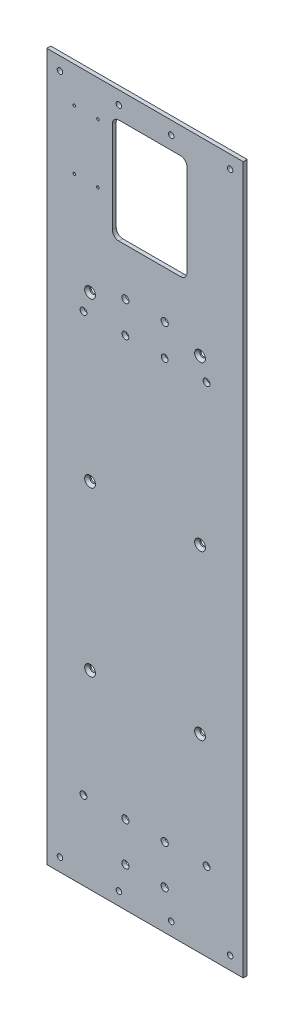
from build123d import *

# Parameters (mm, degrees)
SKETCH_1_W          = 150
SKETCH_1_H          = 540
EXTRUDE_1_DEPTH     = 3
SKETCH_2_R          = 2.1
SKETCH_2_R_2        = 1.6
CUT_EXTRUDE_1_DEPTH = 281.239183556
CUT_EXTRUDE_2_REACH = 282.239
SKETCH_4_R          = 2.1
CHAMFER_1_SIZE      = 2
CUT_EXTRUDE_4_REACH = 282.239
SKETCH_6_R          = 2.6
SKETCH_6_R_2        = 2.600000002
CUT_EXTRUDE_5_REACH = 282.239
SKETCH_7_R          = 2.75
CUT_EXTRUDE_6_REACH = 282.239
SKETCH_8_R          = 2.75
SKETCH_9_R          = 2.75
CUT_EXTRUDE_7_DEPTH = 10
CUT_EXTRUDE_START   = -10
SKETCH_10_W         = 57
SKETCH_10_H         = 80
SKETCH_10_R         = 1.6
CUT_EXTRUDE_8_DEPTH = 10
FILLET_1_R          = 5
CHAMFER_2_SIZE      = 2
SKETCH_11_R         = 1
CUT_EXTRUDE_9_DEPTH = 4


with BuildPart() as part:
    # 草图1 → 凸台-拉伸1 (new body)
    with BuildSketch(Plane.XY):
        Rectangle(SKETCH_1_W, SKETCH_1_H)
    extrude(amount=EXTRUDE_1_DEPTH)

    # 草图2 → 切除-拉伸1 (cut, through all)
    with BuildSketch(Plane(origin=(0, 0, 0), x_dir=(-1, 0, 0), z_dir=(0, 0, -1))):
        with Locations((65, -260)):
            Circle(SKETCH_2_R)
        with Locations((-65, -260)):
            Circle(SKETCH_2_R)
        with Locations((65, 260)):
            Circle(SKETCH_2_R)
        with Locations((-65, 260)):
            Circle(SKETCH_2_R)
        with Locations((-20, -260)):
            Circle(SKETCH_2_R)
        with Locations((20, -260)):
            Circle(SKETCH_2_R)
        with Locations((20, 260)):
            Circle(SKETCH_2_R)
        with Locations((-20, 260)):
            Circle(SKETCH_2_R)
        with Locations((15, 196.5)):
            Circle(SKETCH_2_R_2)
        with Locations((15, 188.5)):
            Circle(SKETCH_2_R_2)
        with Locations((-15, 196.5)):
            Circle(SKETCH_2_R_2)
        with Locations((-15, 188.5)):
            Circle(SKETCH_2_R_2)
    extrude(amount=-CUT_EXTRUDE_1_DEPTH, mode=Mode.SUBTRACT)

    # 草图4 → 切除-拉伸2 (cut, up to next)
    with BuildSketch(Plane.XY.offset(3), mode=Mode.PRIVATE) as cut_extrude_2_sk1:
        with Locations((42, 125)):
            Circle(SKETCH_4_R)
    cut_extrude_2_tool1 = extrude(cut_extrude_2_sk1.sketch, amount=-CUT_EXTRUDE_2_REACH, mode=Mode.PRIVATE) & part.part
    # 草图4 → 切除-拉伸2 (cut, up to next)
    with BuildSketch(Plane.XY.offset(3), mode=Mode.PRIVATE) as cut_extrude_2_sk2:
        with Locations((42, -125)):
            Circle(SKETCH_4_R)
    cut_extrude_2_tool2 = extrude(cut_extrude_2_sk2.sketch, amount=-CUT_EXTRUDE_2_REACH, mode=Mode.PRIVATE) & part.part
    # 草图4 → 切除-拉伸2 (cut, up to next)
    with BuildSketch(Plane.XY.offset(3), mode=Mode.PRIVATE) as cut_extrude_2_sk3:
        with Locations((42, 0)):
            Circle(SKETCH_4_R)
    cut_extrude_2_tool3 = extrude(cut_extrude_2_sk3.sketch, amount=-CUT_EXTRUDE_2_REACH, mode=Mode.PRIVATE) & part.part
    # 草图4 → 切除-拉伸2 (cut, up to next)
    with BuildSketch(Plane.XY.offset(3), mode=Mode.PRIVATE) as cut_extrude_2_sk4:
        with Locations((-42, 0)):
            Circle(SKETCH_4_R)
    cut_extrude_2_tool4 = extrude(cut_extrude_2_sk4.sketch, amount=-CUT_EXTRUDE_2_REACH, mode=Mode.PRIVATE) & part.part
    # 草图4 → 切除-拉伸2 (cut, up to next)
    with BuildSketch(Plane.XY.offset(3), mode=Mode.PRIVATE) as cut_extrude_2_sk5:
        with Locations((-42, -125)):
            Circle(SKETCH_4_R)
    cut_extrude_2_tool5 = extrude(cut_extrude_2_sk5.sketch, amount=-CUT_EXTRUDE_2_REACH, mode=Mode.PRIVATE) & part.part
    # 草图4 → 切除-拉伸2 (cut, up to next)
    with BuildSketch(Plane.XY.offset(3), mode=Mode.PRIVATE) as cut_extrude_2_sk6:
        with Locations((-42, 125)):
            Circle(SKETCH_4_R)
    cut_extrude_2_tool6 = extrude(cut_extrude_2_sk6.sketch, amount=-CUT_EXTRUDE_2_REACH, mode=Mode.PRIVATE) & part.part
    add(cut_extrude_2_tool1.solids().sort_by_distance((42, 125, 3))[0], mode=Mode.SUBTRACT)
    add(cut_extrude_2_tool2.solids().sort_by_distance((42, -125, 3))[0], mode=Mode.SUBTRACT)
    add(cut_extrude_2_tool3.solids().sort_by_distance((42, 0, 3))[0], mode=Mode.SUBTRACT)
    add(cut_extrude_2_tool4.solids().sort_by_distance((-42, 0, 3))[0], mode=Mode.SUBTRACT)
    add(cut_extrude_2_tool5.solids().sort_by_distance((-42, -125, 3))[0], mode=Mode.SUBTRACT)
    add(cut_extrude_2_tool6.solids().sort_by_distance((-42, 125, 3))[0], mode=Mode.SUBTRACT)

    # 倒角1
    chamfer_1_edges = [part.edges().sort_by_distance(p)[0] for p in [
        (39.9, 0, 3),
        (39.9, -125, 3),
        (39.9, 125, 3),
    ]]
    chamfer(chamfer_1_edges, length=CHAMFER_1_SIZE)

    # 草图6 → 切除-拉伸4 (cut, up to next)
    with BuildSketch(Plane.XY.offset(3), mode=Mode.PRIVATE) as cut_extrude_4_sk1:
        with Locations((15, -210)):
            Circle(SKETCH_6_R)
    cut_extrude_4_tool1 = extrude(cut_extrude_4_sk1.sketch, amount=-CUT_EXTRUDE_4_REACH, mode=Mode.PRIVATE) & part.part
    # 草图6 → 切除-拉伸4 (cut, up to next)
    with BuildSketch(Plane.XY.offset(3), mode=Mode.PRIVATE) as cut_extrude_4_sk2:
        with Locations((-15, -210)):
            Circle(SKETCH_6_R)
    cut_extrude_4_tool2 = extrude(cut_extrude_4_sk2.sketch, amount=-CUT_EXTRUDE_4_REACH, mode=Mode.PRIVATE) & part.part
    # 草图6 → 切除-拉伸4 (cut, up to next)
    with BuildSketch(Plane.XY.offset(3), mode=Mode.PRIVATE) as cut_extrude_4_sk3:
        with Locations((47, -210)):
            Circle(SKETCH_6_R)
    cut_extrude_4_tool3 = extrude(cut_extrude_4_sk3.sketch, amount=-CUT_EXTRUDE_4_REACH, mode=Mode.PRIVATE) & part.part
    # 草图6 → 切除-拉伸4 (cut, up to next)
    with BuildSketch(Plane.XY.offset(3), mode=Mode.PRIVATE) as cut_extrude_4_sk4:
        with Locations((-47, -210)):
            Circle(SKETCH_6_R)
    cut_extrude_4_tool4 = extrude(cut_extrude_4_sk4.sketch, amount=-CUT_EXTRUDE_4_REACH, mode=Mode.PRIVATE) & part.part
    # 草图6 → 切除-拉伸4 (cut, up to next)
    with BuildSketch(Plane.XY.offset(3), mode=Mode.PRIVATE) as cut_extrude_4_sk5:
        with Locations((-47, 110)):
            Circle(SKETCH_6_R)
    cut_extrude_4_tool5 = extrude(cut_extrude_4_sk5.sketch, amount=-CUT_EXTRUDE_4_REACH, mode=Mode.PRIVATE) & part.part
    # 草图6 → 切除-拉伸4 (cut, up to next)
    with BuildSketch(Plane.XY.offset(3), mode=Mode.PRIVATE) as cut_extrude_4_sk6:
        with Locations((-15.000000002, 110.000334321)):
            Circle(SKETCH_6_R_2)
    cut_extrude_4_tool6 = extrude(cut_extrude_4_sk6.sketch, amount=-CUT_EXTRUDE_4_REACH, mode=Mode.PRIVATE) & part.part
    # 草图6 → 切除-拉伸4 (cut, up to next)
    with BuildSketch(Plane.XY.offset(3), mode=Mode.PRIVATE) as cut_extrude_4_sk7:
        with Locations((14.999999999, 110.000485978)):
            Circle(SKETCH_6_R)
    cut_extrude_4_tool7 = extrude(cut_extrude_4_sk7.sketch, amount=-CUT_EXTRUDE_4_REACH, mode=Mode.PRIVATE) & part.part
    # 草图6 → 切除-拉伸4 (cut, up to next)
    with BuildSketch(Plane.XY.offset(3), mode=Mode.PRIVATE) as cut_extrude_4_sk8:
        with Locations((47, 110.000647746)):
            Circle(SKETCH_6_R)
    cut_extrude_4_tool8 = extrude(cut_extrude_4_sk8.sketch, amount=-CUT_EXTRUDE_4_REACH, mode=Mode.PRIVATE) & part.part
    add(cut_extrude_4_tool1.solids().sort_by_distance((15, -210, 3))[0], mode=Mode.SUBTRACT)
    add(cut_extrude_4_tool2.solids().sort_by_distance((-15, -210, 3))[0], mode=Mode.SUBTRACT)
    add(cut_extrude_4_tool3.solids().sort_by_distance((47, -210, 3))[0], mode=Mode.SUBTRACT)
    add(cut_extrude_4_tool4.solids().sort_by_distance((-47, -210, 3))[0], mode=Mode.SUBTRACT)
    add(cut_extrude_4_tool5.solids().sort_by_distance((-47, 110, 3))[0], mode=Mode.SUBTRACT)
    add(cut_extrude_4_tool6.solids().sort_by_distance((-15, 110.000334, 3))[0], mode=Mode.SUBTRACT)
    add(cut_extrude_4_tool7.solids().sort_by_distance((15, 110.000486, 3))[0], mode=Mode.SUBTRACT)
    add(cut_extrude_4_tool8.solids().sort_by_distance((47, 110.000648, 3))[0], mode=Mode.SUBTRACT)

    # 草图7 → 切除-拉伸5 (cut, up to next)
    with BuildSketch(Plane.XY.offset(3), mode=Mode.PRIVATE) as cut_extrude_5_sk1:
        with Locations((-15, 134)):
            Circle(SKETCH_7_R)
    cut_extrude_5_tool1 = extrude(cut_extrude_5_sk1.sketch, amount=-CUT_EXTRUDE_5_REACH, mode=Mode.PRIVATE) & part.part
    # 草图7 → 切除-拉伸5 (cut, up to next)
    with BuildSketch(Plane.XY.offset(3), mode=Mode.PRIVATE) as cut_extrude_5_sk2:
        with Locations((15, 134)):
            Circle(SKETCH_7_R)
    cut_extrude_5_tool2 = extrude(cut_extrude_5_sk2.sketch, amount=-CUT_EXTRUDE_5_REACH, mode=Mode.PRIVATE) & part.part
    add(cut_extrude_5_tool1.solids().sort_by_distance((-15, 134, 3))[0], mode=Mode.SUBTRACT)
    add(cut_extrude_5_tool2.solids().sort_by_distance((15, 134, 3))[0], mode=Mode.SUBTRACT)

    # 草图8 → 切除-拉伸6 (cut, up to next)
    with BuildSketch(Plane.XY.offset(3), mode=Mode.PRIVATE) as cut_extrude_6_sk1:
        with Locations((-15, -210)):
            Circle(SKETCH_8_R)
    cut_extrude_6_tool1 = extrude(cut_extrude_6_sk1.sketch, amount=-CUT_EXTRUDE_6_REACH, mode=Mode.PRIVATE) & part.part
    # 草图8 → 切除-拉伸6 (cut, up to next)
    with BuildSketch(Plane.XY.offset(3), mode=Mode.PRIVATE) as cut_extrude_6_sk2:
        with Locations((15, -210)):
            Circle(SKETCH_8_R)
    cut_extrude_6_tool2 = extrude(cut_extrude_6_sk2.sketch, amount=-CUT_EXTRUDE_6_REACH, mode=Mode.PRIVATE) & part.part
    add(cut_extrude_6_tool1.solids().sort_by_distance((-15, -210, 3))[0], mode=Mode.SUBTRACT)
    add(cut_extrude_6_tool2.solids().sort_by_distance((15, -210, 3))[0], mode=Mode.SUBTRACT)

    # 草图9 → 切除-拉伸7 (cut)
    with BuildSketch(Plane.XY.offset(3)):
        with Locations((-15, -240)):
            Circle(SKETCH_9_R)
        with Locations((15, -240)):
            Circle(SKETCH_9_R)
    extrude(amount=-CUT_EXTRUDE_7_DEPTH, mode=Mode.SUBTRACT)

    # 草图10 → 切除-拉伸8 (cut)
    with BuildSketch(Plane.XY.offset(3).offset(CUT_EXTRUDE_START)):
        with Locations((3.5, 210)):
            Rectangle(SKETCH_10_W, SKETCH_10_H)
        with Locations((-15, 188.5)):
            Circle(SKETCH_10_R, mode=Mode.SUBTRACT)
        with Locations((-15, 196.5)):
            Circle(SKETCH_10_R, mode=Mode.SUBTRACT)
        with Locations((15, 196.5)):
            Circle(SKETCH_10_R, mode=Mode.SUBTRACT)
        with Locations((15, 188.5)):
            Circle(SKETCH_10_R, mode=Mode.SUBTRACT)
    extrude(amount=CUT_EXTRUDE_8_DEPTH, mode=Mode.SUBTRACT)

    # 圆角1
    fillet_1_edges = [part.edges().sort_by_distance(p)[0] for p in [
        (-25, 170, 1.5),
        (-25, 250, 1.5),
        (32, 170, 1.5),
        (32, 250, 1.5),
    ]]
    fillet(fillet_1_edges, radius=FILLET_1_R)

    # 倒角2
    chamfer_2_edges = [part.edges().sort_by_distance(p)[0] for p in [
        (-44.1, -125, 3),
        (-44.1, 0, 3),
        (-44.1, 125, 3),
    ]]
    chamfer(chamfer_2_edges, length=CHAMFER_2_SIZE)

    # 草图11 → 切除-拉伸9 (cut)
    with BuildSketch(Plane.XY.offset(3)):
        with Locations((-54, 242.6)):
            Circle(SKETCH_11_R)
        with Locations((-36, 242.6)):
            Circle(SKETCH_11_R)
        with Locations((-36, 197.4)):
            Circle(SKETCH_11_R)
        with Locations((-54, 197.4)):
            Circle(SKETCH_11_R)
    extrude(amount=-CUT_EXTRUDE_9_DEPTH, mode=Mode.SUBTRACT)


solid = part.part
